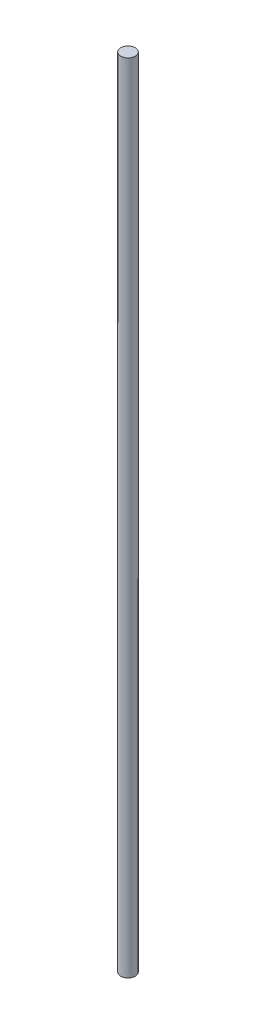
from build123d import *

# Parameters (mm, degrees)
SKETCH1_R           = 2.5
BOSS_EXTRUDE1_DEPTH = 273.2


with BuildPart() as part:
    # Sketch1 → Boss-Extrude1 (new body)
    with BuildSketch(Plane(origin=(0, 0, 0), x_dir=(1, 0, 0), z_dir=(0, 1, 0))):
        Circle(SKETCH1_R)
    extrude(amount=BOSS_EXTRUDE1_DEPTH)


solid = part.part
